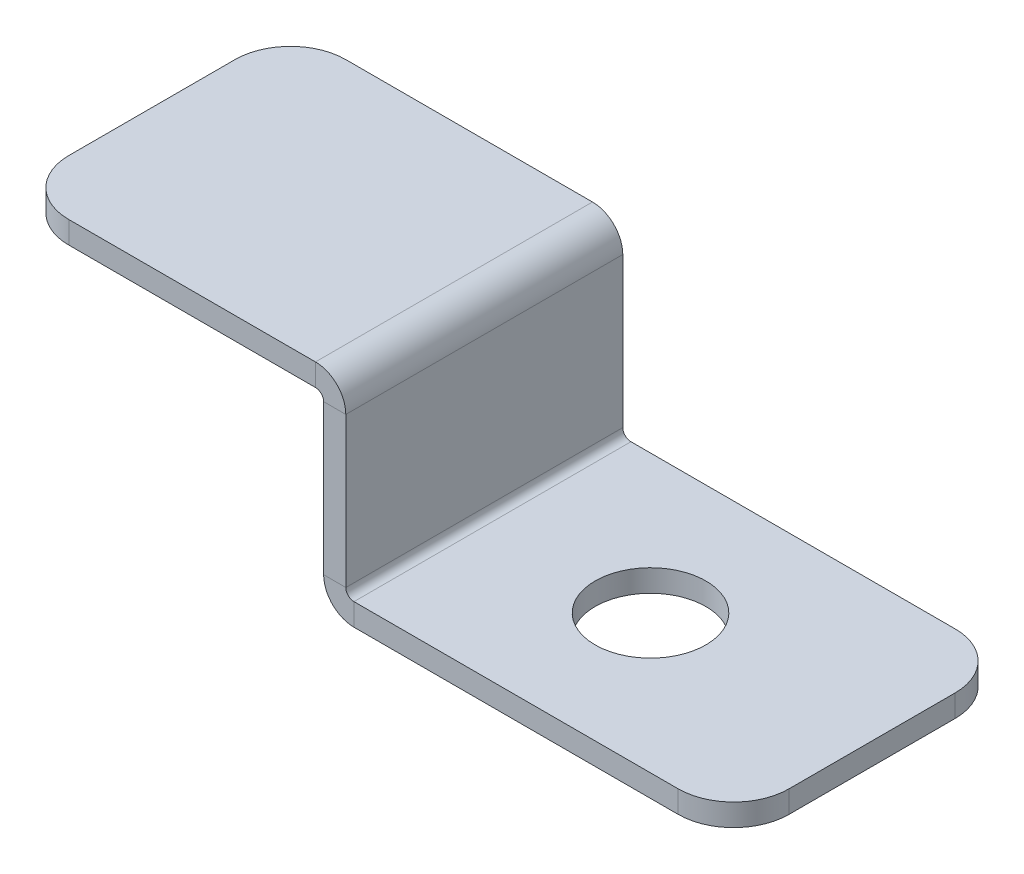
from build123d import *

# Parameters (mm, degrees)
TABAN_FLAN_1_DEPTH    = 12.5
K_ELERI_START         = -19
K_ELERI_K_R1_DEPTH    = 19
IZIM2_R               = 5
KES_EKSTR_ZYON1_DEPTH = 10


# Read off the part's stored shape, not the designer's step: Köşeleri kır1
# Sheet-metal steps are written as plain solids
with BuildPart() as part:
    # Çizim1 → Taban-Flanş1 (new, symmetric)
    with BuildSketch(Plane.XY):
        with BuildLine():
            Line((0, 0), (27.2634, 0))
            ThreePointArc((27.2634, 0), (29.198468417, -0.801531583), (30, -2.7366))
            Line((30, -2.7366), (30, -16.2634))
            ThreePointArc((30, -16.2634), (30.215745145, -16.784254855), (30.7366, -17))
            Line((30.7366, -17), (65, -17))
            Line((65, -17), (65, -19))
            Line((65, -19), (30.7366, -19))
            ThreePointArc((30.7366, -19), (28.801531583, -18.198468417), (28, -16.2634))
            Line((28, -16.2634), (28, -2.7366))
            ThreePointArc((28, -2.7366), (27.784254855, -2.215745145), (27.2634, -2))
            Line((27.2634, -2), (0, -2))
            Line((0, -2), (0, 0))
        make_face()
    extrude(amount=TABAN_FLAN_1_DEPTH, both=True)

    # Köşeleri kır1 outline → Köşeleri kır1 (cut)
    with BuildSketch(Plane(origin=(0, 0, 0), x_dir=(1, 0, 0), z_dir=(0, 1, 0)).offset(K_ELERI_START)):
        with BuildLine():
            Line((0, -12.5), (5, -12.5))
            ThreePointArc((5, -12.5), (1.464466094, -11.035533906), (0, -7.5))
            Line((0, -7.5), (0, -12.5))
        make_face()
        with BuildLine():
            Line((0, 12.5), (0, 7.5))
            ThreePointArc((0, 7.5), (1.464466094, 11.035533906), (5, 12.5))
            Line((5, 12.5), (0, 12.5))
        make_face()
        with BuildLine():
            Line((65, -12.5), (65, -7.5))
            ThreePointArc((65, -7.5), (63.535533906, -11.035533906), (60, -12.5))
            Line((60, -12.5), (65, -12.5))
        make_face()
        with BuildLine():
            ThreePointArc((60, 12.5), (63.535533906, 11.035533906), (65, 7.5))
            Line((65, 7.5), (65, 12.5))
            Line((65, 12.5), (60, 12.5))
        make_face()
    extrude(amount=K_ELERI_K_R1_DEPTH, mode=Mode.SUBTRACT)

    # Çizim2 → Kes-Ekstrüzyon1 (cut)
    with BuildSketch(Plane(origin=(0, -17, 0), x_dir=(1, 0, 0), z_dir=(0, 1, 0))):
        with Locations(Location((45, 0, 0), (0, 0, 270))):
            Circle(IZIM2_R)
    extrude(amount=-KES_EKSTR_ZYON1_DEPTH, mode=Mode.SUBTRACT)


solid = part.part
